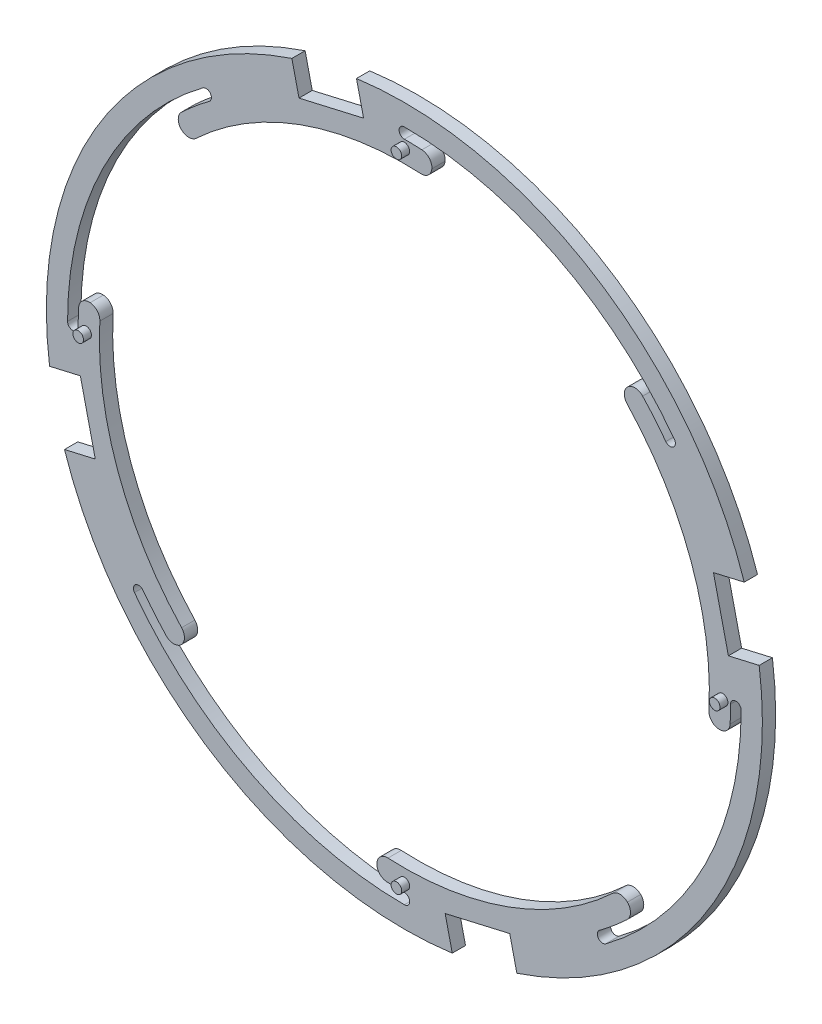
from build123d import *

# Parameters (mm, degrees)
SCHIZZO1_R                   = 135
ESTRUSIONE_ESTRUSIONE1_DEPTH = 5
SCHIZZO2_R                   = 115
TAGLIO_ESTRUSIONE1_DEPTH     = 191.984292548
SCHIZZO3_R                   = 2
ESTRUSIONE_ESTRUSIONE2_DEPTH = 3
RIPETIZIONECIRCOLARE1_COUNT  = 4
TAGLIO_ESTRUSIONE2_DEPTH     = 10
RIPETIZIONECIRCOLARE2_COUNT  = 4
TAGLIO_ESTRUSIONE21_DEPTH    = 8
RIPETIZIONECIRCOLARE3_COUNT  = 4
TAGLIO_ESTRUSIONE23_DEPTH    = 10
RIPETIZIONECIRCOLARE5_COUNT  = 4
RACCORDO1_R                  = 4
RACCORDO2_R                  = 4


with BuildPart() as part:
    # Schizzo1 → Estrusione-Estrusione1 (new body)
    with BuildSketch(Plane.XY):
        Circle(SCHIZZO1_R)
    extrude(amount=ESTRUSIONE_ESTRUSIONE1_DEPTH)

    # Schizzo2 → Taglio-Estrusione1 (cut, through all)
    with BuildSketch(Plane.XY.offset(5)):
        Circle(SCHIZZO2_R)
    extrude(amount=-TAGLIO_ESTRUSIONE1_DEPTH, mode=Mode.SUBTRACT)

    # Schizzo3 → Estrusione-Estrusione2 (add)
    with BuildSketch(Plane.XY.offset(5)):
        with Locations((0, 120)):
            Circle(SCHIZZO3_R)
    estrusione_estrusione2 = extrude(amount=ESTRUSIONE_ESTRUSIONE2_DEPTH)

    # RipetizioneCircolare1: Estrusione-Estrusione2 ×4 about axis
    ripetizionecircolare1_axis = Axis((0, 0, 0), (0, 0, 1))
    for i in range(1, RIPETIZIONECIRCOLARE1_COUNT):
        add(estrusione_estrusione2.rotate(ripetizionecircolare1_axis, i * 360 / RIPETIZIONECIRCOLARE1_COUNT))

    # Schizzo5 → Taglio-Estrusione2 (cut)
    with BuildSketch(Plane.XY.offset(5)):
        with BuildLine():
            ThreePointArc((-101.785752557, -75.95169897), (-56.934761924, -113.522829795), (0, -127))
            ThreePointArc((0, -127), (2, -125), (0, -123))
            ThreePointArc((0, -123), (-55.141541076, -109.947307596), (-98.579902083, -73.559519475))
            ThreePointArc((-98.579902083, -73.559519475), (-101.378917067, -73.152683985), (-101.785752557, -75.95169897))
        make_face()
    taglio_estrusione2 = extrude(amount=-TAGLIO_ESTRUSIONE2_DEPTH, mode=Mode.SUBTRACT)

    # RipetizioneCircolare2: Taglio-Estrusione2 ×4 about axis
    ripetizionecircolare2_axis = Axis((0, 0, 0), (0, 0, 1))
    for i in range(1, RIPETIZIONECIRCOLARE2_COUNT):
        add(taglio_estrusione2.rotate(ripetizionecircolare2_axis, i * 360 / RIPETIZIONECIRCOLARE2_COUNT), mode=Mode.SUBTRACT)

    # Schizzo14 → Taglio-Estrusione21 (cut)
    with BuildSketch(Plane.XY):
        Polygon((-39.736129967, 116.548444757), (-45.359906326, 140.907696377), (-21.000654706, 146.531472735), (-15.376878347, 122.172221115), align=None)
    taglio_estrusione21 = extrude(amount=TAGLIO_ESTRUSIONE21_DEPTH, mode=Mode.SUBTRACT)

    # RipetizioneCircolare3: Taglio-Estrusione21 ×4 about axis
    ripetizionecircolare3_axis = Axis((0, 0, 0), (0, 0, 1))
    for i in range(1, RIPETIZIONECIRCOLARE3_COUNT):
        add(taglio_estrusione21.rotate(ripetizionecircolare3_axis, i * 360 / RIPETIZIONECIRCOLARE3_COUNT), mode=Mode.SUBTRACT)

    # Schizzo15 → Taglio-Estrusione23 (cut)
    with BuildSketch(Plane.XY.offset(5)):
        with BuildLine():
            Line((-86.974134086, 86.974134086), (-81.317279836, 81.317279836))
            ThreePointArc((-81.317279836, 81.317279836), (-104.225395509, 48.6011001), (-114.562390281, 10.022910416))
            Line((-114.562390281, 10.022910416), (-122.531947865, 10.720156358))
            ThreePointArc((-122.531947865, 10.720156358), (-111.475857806, 51.982046194), (-86.974134086, 86.974134086))
        make_face()
    taglio_estrusione23 = extrude(amount=-TAGLIO_ESTRUSIONE23_DEPTH, mode=Mode.SUBTRACT)

    # RipetizioneCircolare5: Taglio-Estrusione23 ×4 about axis
    ripetizionecircolare5_axis = Axis((0, 0, 5), (0, 0, 1))
    for i in range(1, RIPETIZIONECIRCOLARE5_COUNT):
        add(taglio_estrusione23.rotate(ripetizionecircolare5_axis, i * 360 / RIPETIZIONECIRCOLARE5_COUNT), mode=Mode.SUBTRACT)

    # Raccordo1
    raccordo1_edges = [part.edges().sort_by_distance(p)[0] for p in [
        (-114.562390281, 10.022910416, 2.5),
        (-122.531947865, 10.720156358, 2.5),
    ]]
    fillet(raccordo1_edges, radius=RACCORDO1_R - 0.0001)  # a hair under: the kernel refuses the full size

    # Raccordo2
    raccordo2_edges = [part.edges().sort_by_distance(p)[0] for p in [
        (-81.317279836, -81.317279836, 2.5),
        (-86.974134086, -86.974134086, 2.5),
        (-10.022910416, -114.562390281, 2.5),
        (-10.720156358, -122.531947865, 2.5),
        (86.974134086, -86.974134086, 2.5),
        (81.317279836, -81.317279836, 2.5),
        (114.562390281, -10.022910416, 2.5),
        (122.531947865, -10.720156358, 2.5),
        (86.974134086, 86.974134086, 2.5),
        (81.317279836, 81.317279836, 2.5),
        (10.720156358, 122.531947865, 2.5),
        (10.022910416, 114.562390281, 2.5),
        (-81.317279836, 81.317279836, 2.5),
        (-86.974134086, 86.974134086, 2.5),
    ]]
    fillet(raccordo2_edges, radius=RACCORDO2_R - 0.0001)  # a hair under: the kernel refuses the full size


solid = part.part
